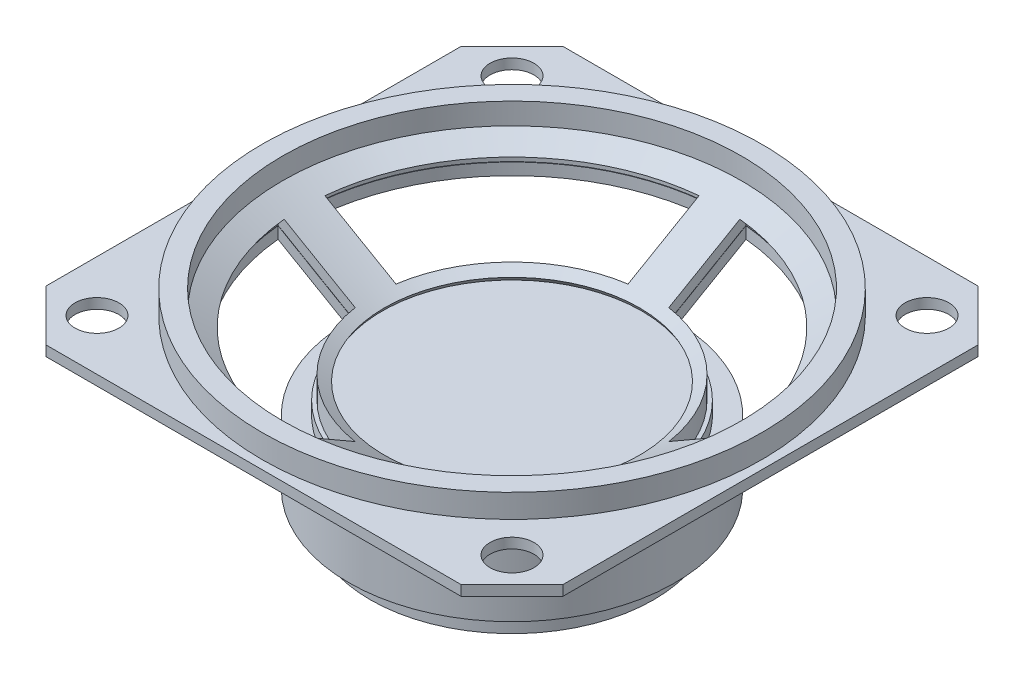
from build123d import *

# Parameters (mm, degrees)
SKETCH1_R           = 2.15
SKETCH1_R_2         = 22.5
BOSS_EXTRUDE1_DEPTH = 1
SKETCH2_R           = 24.5
SKETCH2_R_2         = 22.5
BOSS_EXTRUDE2_DEPTH = 2.3
SKETCH3_R           = 13.9
BOSS_EXTRUDE3_DEPTH = 11.2
SKETCH4_R           = 16
BOSS_EXTRUDE4_DEPTH = 6.2
CUT_EXTRUDE1_DEPTH  = 6.2


# Read off the part's stored shape, not the designer's step: Revolve-Thin3
with BuildPart() as part:
    # Sketch1 → Boss-Extrude1 (new body)
    with BuildSketch(Plane(origin=(0, 0, 0), x_dir=(1, 0, 0), z_dir=(0, 1, 0))):
        Polygon((-45.7, 0), (-5, 0), (0, 5), (0, 45.7), (-5, 50.7), (-45.7, 50.7), (-50.7, 45.7), (-50.7, 5), align=None)
        with Locations(Location((-45.7, 5, 0), (0, 0, 270))):
            Circle(SKETCH1_R, mode=Mode.SUBTRACT)
        with Locations(Location((-5, 5, 0), (0, 0, 270))):
            Circle(SKETCH1_R, mode=Mode.SUBTRACT)
        with Locations(Location((-25.35, 25.35, 0), (0, 0, 270))):
            Circle(SKETCH1_R_2, mode=Mode.SUBTRACT)
        with Locations(Location((-45.7, 45.7, 0), (0, 0, 270))):
            Circle(SKETCH1_R, mode=Mode.SUBTRACT)
        with Locations(Location((-5, 45.7, 0), (0, 0, 270))):
            Circle(SKETCH1_R, mode=Mode.SUBTRACT)
    extrude(amount=BOSS_EXTRUDE1_DEPTH)

    # Sketch2 → Boss-Extrude2 (add)
    with BuildSketch(Plane(origin=(0, 1, 0), x_dir=(1, 0, 0), z_dir=(0, 1, 0))):
        with Locations(Location((-25.35, 25.35, 0), (0, 0, 270))):
            Circle(SKETCH2_R)
        with Locations(Location((-25.35, 25.35, 0), (0, 0, 270))):
            Circle(SKETCH2_R_2, mode=Mode.SUBTRACT)
    extrude(amount=BOSS_EXTRUDE2_DEPTH)



with BuildPart() as body_2:
    # Sketch3 → Boss-Extrude3 (new body)
    with BuildSketch(Plane.XZ.offset(5)):
        with Locations(Location((-25.35, -25.35, 0), (0, 0, 270))):
            Circle(SKETCH3_R)
    extrude(amount=BOSS_EXTRUDE3_DEPTH)

    # Sketch4 → Boss-Extrude4 (add)
    with BuildSketch(Plane(origin=(0, -7.5, 0), x_dir=(1, 0, 0), z_dir=(0, 1, 0))):
        with Locations(Location((-25.35, 25.35, 0), (0, 0, 270))):
            Circle(SKETCH4_R)
    extrude(amount=-BOSS_EXTRUDE4_DEPTH)


with BuildPart() as part_1:
    add(part.part)

    add(body_2.part)  # Revolve-Thin3 merges body 2
    # Revolve-Thin3 outline → Revolve-Thin3 (revolve)
    with BuildSketch(Plane(origin=(-25.35, 0, -25.35), x_dir=(1, 0, 0), z_dir=(0, 0, 1))):
        Polygon((12.516199773, -4.609436428), (12.743271617, -5), (13.9, -5), (13.883327417, -4.971323157), (22.483327417, 0.028676843), (22.5, 0), (22.5, 1.195098588), align=None)
        Polygon((22.5, 0), (13.9, -5), (13.9, -6.156728383), (23.867127644, -0.361886729), (23.656728383, 0), align=None)
    revolve(axis=Axis((-25.35, 0, -25.35), (0, 1, 0)))

    # Sketch6 → Cut-Extrude1 (cut)
    with BuildSketch(Plane(origin=(0, 0, 0), x_dir=(1, 0, 0), z_dir=(0, 1, 0))):
        with BuildLine():
            ThreePointArc((-27.35, 11.972214326), (-34.91465236, 15.78534764), (-38.727785674, 23.35))
            Line((-38.727785674, 23.35), (-46.295518861, 23.35))
            ThreePointArc((-46.295518861, 23.35), (-40.228083888, 10.471916112), (-27.35, 4.404481139))
            Line((-27.35, 4.404481139), (-27.35, 11.972214326))
        make_face()
        with BuildLine():
            Line((-46.295518861, 27.35), (-38.727785674, 27.35))
            ThreePointArc((-38.727785674, 27.35), (-34.91465236, 34.91465236), (-27.35, 38.727785674))
            Line((-27.35, 38.727785674), (-27.35, 46.295518861))
            ThreePointArc((-27.35, 46.295518861), (-40.228083888, 40.228083888), (-46.295518861, 27.35))
        make_face()
        with BuildLine():
            Line((-23.35, 46.295518861), (-23.35, 38.727785674))
            ThreePointArc((-23.35, 38.727785674), (-15.78534764, 34.91465236), (-11.972214326, 27.35))
            Line((-11.972214326, 27.35), (-4.404481139, 27.35))
            ThreePointArc((-4.404481139, 27.35), (-10.471916112, 40.228083888), (-23.35, 46.295518861))
        make_face()
        with BuildLine():
            ThreePointArc((-11.972214326, 23.35), (-15.78534764, 15.78534764), (-23.35, 11.972214326))
            Line((-23.35, 11.972214326), (-23.35, 4.404481139))
            ThreePointArc((-23.35, 4.404481139), (-10.471916112, 10.471916112), (-4.404481139, 23.35))
            Line((-4.404481139, 23.35), (-11.972214326, 23.35))
        make_face()
    extrude(amount=-CUT_EXTRUDE1_DEPTH, mode=Mode.SUBTRACT)


solid = part_1.part
